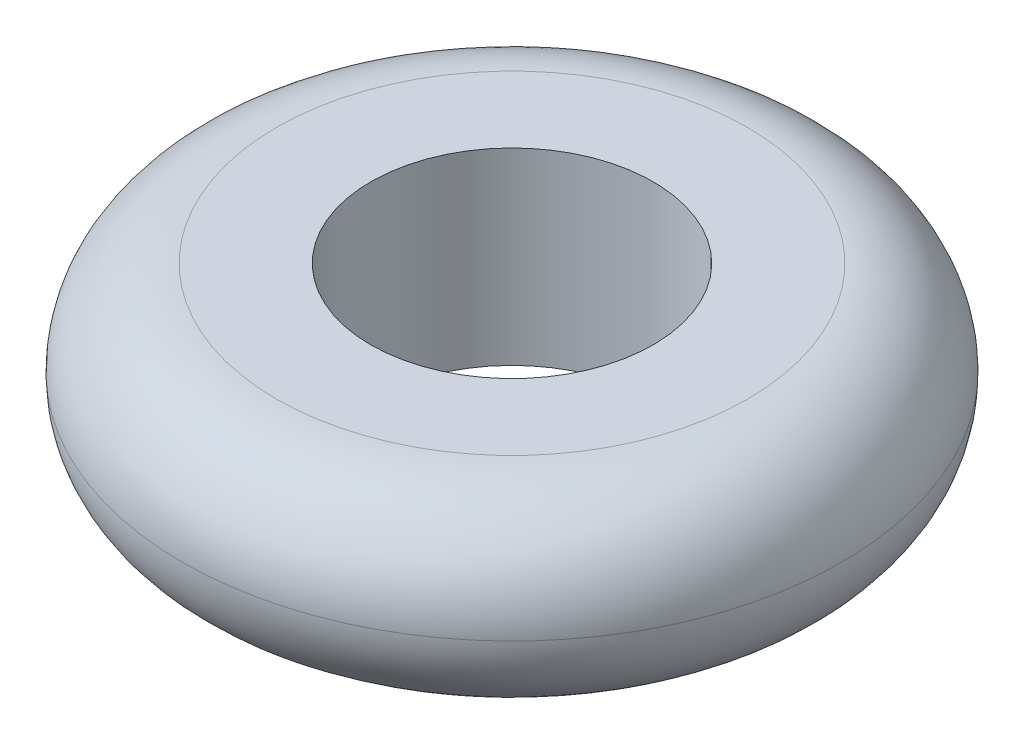
from build123d import *

# Parameters (mm, degrees)
SKETCH1_R           = 1.75
SKETCH1_R_2         = 0.75
BOSS_EXTRUDE1_DEPTH = 1
FILLET1_R           = 0.5


with BuildPart() as part:
    # Sketch1 → Boss-Extrude1 (new body)
    with BuildSketch(Plane(origin=(0, 0, 0), x_dir=(1, 0, 0), z_dir=(0, 1, 0))):
        with Locations(Location((0, 0.37701436, 0), (0, 0, 270))):
            Circle(SKETCH1_R)
        with Locations(Location((0, 0.37701436, 0), (0, 0, 270))):
            Circle(SKETCH1_R_2, mode=Mode.SUBTRACT)
    extrude(amount=BOSS_EXTRUDE1_DEPTH)

    # Fillet1
    fillet1_edges = [part.edges().sort_by_distance(p)[0] for p in [
        (0, 0, -2.12701436),
        (0, 1, -2.12701436),
    ]]
    fillet(fillet1_edges, radius=FILLET1_R - 0.0001)  # a hair under: the kernel refuses the full size


solid = part.part
